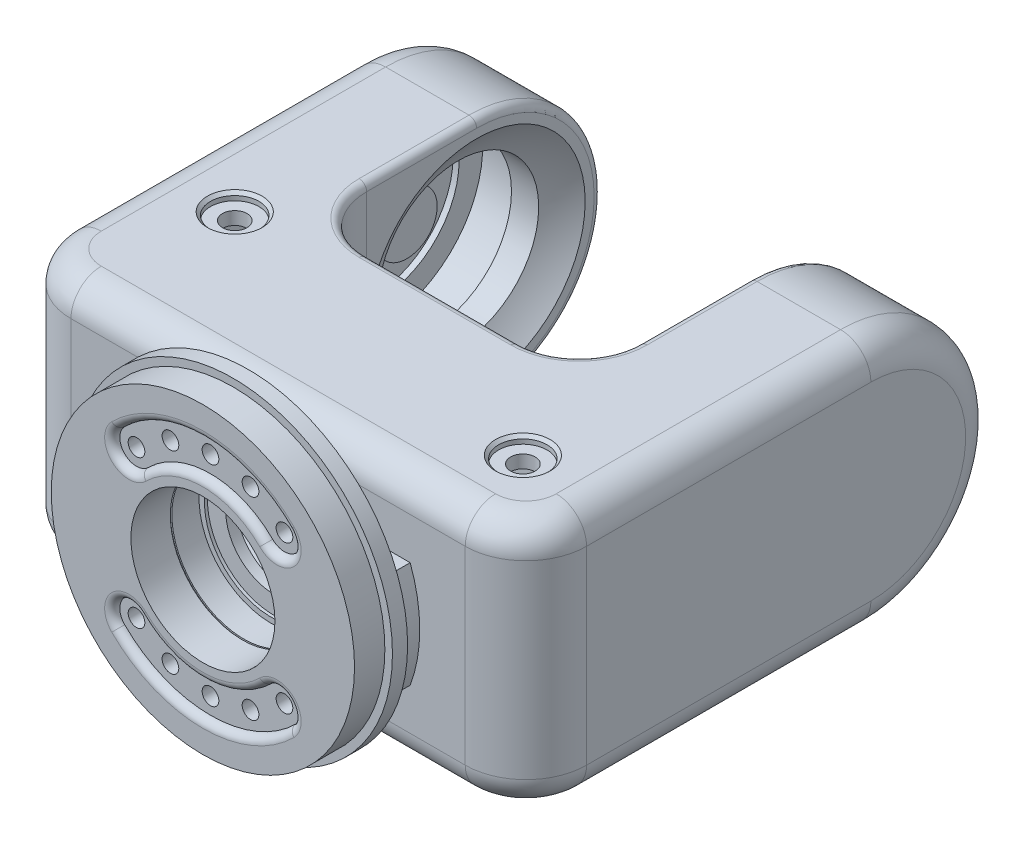
from build123d import *
from build123d.topology import SkipClean

# Parameters (mm, degrees)
SKETCH1_R                  = 100
EXTRUDE1_DEPTH             = 15
F_11_0_11_DIAMETER_HOLE3_D = 11
EXTRUDE2_DEPTH             = 5
FILLET1_R                  = 5
SKETCH12_R                 = 58
EXTRUDE6_DEPTH             = 23
EXTRUDE7_REACH             = 153.026
EXTRUDE12_DEPTH            = 82.5
FILLET2_RADIUS             = 82.5
FILLET2_LENGTH             = 80
FILLET3_RADIUS             = 82.5
FILLET3_LENGTH             = 80
EXTRUDE13_DEPTH            = 69
FILLET4_R                  = 20
SKETCH24_R                 = 53
EXTRUDE14_DEPTH            = 155
SKETCH27_R                 = 69
EXTRUDE16_DEPTH            = 35
EXTRUDE17_START            = 35
SKETCH28_R                 = 69
EXTRUDE17_DEPTH            = 35
SKETCH30_R                 = 53.5
EXTRUDE18_DEPTH            = 4
FILLET5_R                  = 8
SKETCH34_R                 = 26
EXTRUDE19_DEPTH            = 138
SKETCH35_R                 = 16
EXTRUDE21_DEPTH            = 5
CHAMFER2_SIZE              = 2
EXTRUDE22_DEPTH            = 392.336173
EXTRUDE22_DEPTH_BACK       = 392.336173
SKETCH36_R                 = 8.1
FILLET6_R                  = 5
SKETCH37_R                 = 105
SKETCH37_R_2               = 100
EXTRUDE23_DEPTH            = 10


with BuildPart() as part:
    # Sketch1 → Extrude1 (new, symmetric)
    with BuildSketch(Plane.XY):
        Circle(SKETCH1_R)
    extrude(amount=EXTRUDE1_DEPTH, both=True)

    # Ø11.0 (11) Diameter Hole3 (through all)
    with Locations(Plane(origin=(0, 0, -15), x_dir=(-1, 0, 0), z_dir=(0, 0, -1))):
        with Locations((-48.790368, 48.790368), (-26.405157, 63.747688), (0, 69), (26.405157, 63.747688), (48.790368, 48.790368), (48.790368, -48.790368), (26.405157, -63.747688), (0, -69), (-26.405157, -63.747688), (-48.790368, -48.790368)):
            Hole(F_11_0_11_DIAMETER_HOLE3_D / 2)

    # Sketch2 → Extrude2 (cut)
    with BuildSketch(Plane.XY.offset(15)):
        with BuildLine():
            ThreePointArc((56.568542, 56.568542), (0, 80), (-56.568542, 56.568542))
            ThreePointArc((-56.568542, 56.568542), (-56.568542, 41.012193), (-41.012193, 41.012193))
            ThreePointArc((-41.012193, 41.012193), (0, 58), (41.012193, 41.012193))
            ThreePointArc((41.012193, 41.012193), (56.568542, 41.012193), (56.568542, 56.568542))
        make_face()
        with BuildLine():
            ThreePointArc((56.568542, -56.568542), (0, -80), (-56.568542, -56.568542))
            ThreePointArc((-56.568542, -56.568542), (-56.568542, -41.012193), (-41.012193, -41.012193))
            ThreePointArc((-41.012193, -41.012193), (0, -58), (41.012193, -41.012193))
            ThreePointArc((41.012193, -41.012193), (56.568542, -41.012193), (56.568542, -56.568542))
        make_face()
    extrude(amount=-EXTRUDE2_DEPTH, mode=Mode.SUBTRACT)

    # Fillet1
    fillet1_edges = [part.edges().sort_by_distance(p)[0] for p in [
        (-56.568542, -41.012193, 15),
        (0, -80, 15),
        (56.568542, -41.012193, 15),
        (0, -58, 15),
        (0, 80, 15),
        (-56.568542, 41.012193, 15),
        (56.568542, 41.012193, 15),
        (0, 58, 15),
    ]]
    fillet(fillet1_edges, radius=FILLET1_R - 0.0001)  # a hair under: the kernel refuses the full size

    # Sketch12 → Extrude6 (add)
    with BuildSketch(Plane(origin=(0, 0, -15), x_dir=(-1, 0, 0), z_dir=(0, 0, -1))):
        with Locations(Location((0, 0, 0), (0, 0, 180))):
            Circle(SKETCH12_R)
    extrude(amount=EXTRUDE6_DEPTH)

    # Sketch15 → Cut-Revolve1 (revolve, cut)
    with BuildSketch(Plane(origin=(0, 0, 0), x_dir=(1, 0, 0), z_dir=(0, 1, 0))):
        Polygon((0, 38), (32, 38), (32, 32), (44, 32), (44, 30), (47.5, 30), (47.5, 12), (48.5, 12), (48.5, 11), (47.5, 11), (47.5, -15), (0, -15), align=None)
    revolve(axis=Axis((0, 0, 15), (0, 0, -1)), mode=Mode.SUBTRACT)

    # Sketch16 → Extrude7 (add, up to next)
    with BuildSketch(Plane(origin=(0, 0, -38), x_dir=(-1, 0, 0), z_dir=(0, 0, -1)), mode=Mode.PRIVATE) as extrude7_sk1:
        with BuildLine():
            Line((-93.67497, 35), (-46.249324, 35))
            ThreePointArc((-46.249324, 35), (-58, 0), (-46.249324, -35))
            Line((-46.249324, -35), (-93.67497, -35))
            ThreePointArc((-93.67497, -35), (-100, 0), (-93.67497, 35))
        make_face()
    extrude7_tool1 = extrude(extrude7_sk1.sketch, amount=-EXTRUDE7_REACH, mode=Mode.PRIVATE) - part.part
    # Sketch16 → Extrude7 (add, up to next)
    with BuildSketch(Plane(origin=(0, 0, -38), x_dir=(-1, 0, 0), z_dir=(0, 0, -1)), mode=Mode.PRIVATE) as extrude7_sk2:
        with BuildLine():
            Line((46.249324, 35), (93.67497, 35))
            ThreePointArc((93.67497, 35), (100, 0), (93.67497, -35))
            Line((93.67497, -35), (46.249324, -35))
            ThreePointArc((46.249324, -35), (58, 0), (46.249324, 35))
        make_face()
    extrude7_tool2 = extrude(extrude7_sk2.sketch, amount=-EXTRUDE7_REACH, mode=Mode.PRIVATE) - part.part
    add(extrude7_tool1.solids().sort_by_distance((75.992672, 0, -38))[0])
    add(extrude7_tool2.solids().sort_by_distance((-75.992672, 0, -38))[0])

    # Sketch20 → Extrude12 (add, symmetric)
    with BuildSketch(Plane(origin=(0, 0, 0), x_dir=(1, 0, 0), z_dir=(0, 1, 0))):
        with BuildLine():
            Line((-50, 143), (50, 143))
            ThreePointArc((50, 143), (78.284271, 154.715729), (90, 183))
            Line((90, 183), (90, 338))
            Line((90, 338), (170, 338))
            Line((170, 338), (170, 68))
            ThreePointArc((170, 68), (158.284271, 39.715729), (130, 28))
            Line((130, 28), (-130, 28))
            ThreePointArc((-130, 28), (-158.284271, 39.715729), (-170, 68))
            Line((-170, 68), (-170, 338))
            Line((-170, 338), (-90, 338))
            Line((-90, 338), (-90, 183))
            ThreePointArc((-90, 183), (-78.284271, 154.715729), (-50, 143))
        make_face()
    extrude(amount=EXTRUDE12_DEPTH, both=True)

    # Fillet2: full round fillet: the end face becomes a half cylinder, R = half its width
    fillet2_face = Plane((130, 0, -338), x_dir=(-1, 0, 0), z_dir=(0, 0, -1))  # on the end face: x along it, z out of the body
    fillet2_slab = fillet2_face.offset(-FILLET2_RADIUS / 2) * Box(FILLET2_LENGTH, 2 * FILLET2_RADIUS, FILLET2_RADIUS, mode=Mode.PRIVATE)  # the body's end, R deep
    fillet2_round = Plane((130, 0, -255.5), x_dir=(0, 0, -1), z_dir=(-1, 0, 0)) * Cylinder(FILLET2_RADIUS, FILLET2_LENGTH, mode=Mode.PRIVATE)  # its axis R under the face
    add(fillet2_slab - fillet2_round, mode=Mode.SUBTRACT)

    # Fillet3: full round fillet: the end face becomes a half cylinder, R = half its width
    fillet3_face = Plane((-130, 0, -338), x_dir=(-1, 0, 0), z_dir=(0, 0, -1))  # on the end face: x along it, z out of the body
    fillet3_slab = fillet3_face.offset(-FILLET3_RADIUS / 2) * Box(FILLET3_LENGTH, 2 * FILLET3_RADIUS, FILLET3_RADIUS, mode=Mode.PRIVATE)  # the body's end, R deep
    fillet3_round = Plane((-130, 0, -255.5), x_dir=(0, 0, -1), z_dir=(-1, 0, 0)) * Cylinder(FILLET3_RADIUS, FILLET3_LENGTH, mode=Mode.PRIVATE)  # its axis R under the face
    add(fillet3_slab - fillet3_round, mode=Mode.SUBTRACT)

    # Sketch21 → Cut-Revolve2 (revolve, cut)
    with BuildSketch(Plane(origin=(0, 0, 0), x_dir=(1, 0, 0), z_dir=(0, 1, 0)), mode=Mode.PRIVATE) as cut_revolve2_sk:
        with BuildLine():
            Line((0, 370.5), (0, 153))
            Line((0, 153), (52.141634, 153))
            ThreePointArc((52.141634, 153), (111.831346, 282.309513), (0, 370.5))
        make_face()
    revolve(cut_revolve2_sk.sketch.rotate(Axis((0, 0, -370.5), (0, 0, 1)), 159.512685), axis=Axis((0, 0, -370.5), (0, 0, 1)), mode=Mode.SUBTRACT)

    # Sketch23 → Extrude13 (cut, symmetric)
    with BuildSketch(Plane(origin=(0, 0, 0), x_dir=(1, 0, 0), z_dir=(0, 1, 0))):
        with BuildLine():
            Line((-155, 255.5), (-120, 255.5))
            Line((-120, 255.5), (-120, 168))
            ThreePointArc((-120, 168), (-108.284271, 139.715729), (-80, 128))
            Line((-80, 128), (80, 128))
            ThreePointArc((80, 128), (108.284271, 139.715729), (120, 168))
            Line((120, 168), (120, 255.5))
            Line((120, 255.5), (155, 255.5))
            Line((155, 255.5), (155, 86))
            ThreePointArc((155, 86), (143.284271, 57.715729), (115, 46))
            Line((115, 46), (-115, 46))
            ThreePointArc((-115, 46), (-143.284271, 57.715729), (-155, 86))
            Line((-155, 86), (-155, 255.5))
        make_face()
    extrude(amount=EXTRUDE13_DEPTH, both=True, mode=Mode.SUBTRACT)

    # Fillet4
    fillet4_edges = [part.edges().sort_by_distance(p)[0] for p in [
        (-158.284271, -82.5, -39.715729),
        (0, -82.5, -28),
        (158.284271, -82.5, -39.715729),
        (170, -82.5, -161.75),
        (-158.284271, 82.5, -39.715729),
        (0, 82.5, -28),
        (158.284271, 82.5, -39.715729),
        (170, 82.5, -161.75),
        (170, -58.336309, -313.836309),
        (-170, -82.5, -161.75),
        (-170, 82.5, -161.75),
        (-170, -58.336309, -313.836309),
    ]]
    fillet(fillet4_edges, radius=FILLET4_R)

    # Sketch24 → Extrude14 (cut, symmetric)
    with SkipClean():  # the faces are left unmerged after this step: merging them gives an invalid solid
        with BuildSketch(Plane(origin=(0, 0, 0), x_dir=(0, 0, -1), z_dir=(1, 0, 0))):
            with Locations(Location((255.5, 0, 0), (0, 0, 90))):
                Circle(SKETCH24_R)
        extrude(amount=EXTRUDE14_DEPTH, both=True, mode=Mode.SUBTRACT)

    # Sketch27 → Extrude16 (cut)
    with SkipClean():  # the faces are left unmerged after this step: merging them gives an invalid solid
        with BuildSketch(Plane(origin=(-155, 0, 0), x_dir=(0, 0, -1), z_dir=(1, 0, 0))):
            with Locations((255.5, 0)):
                Circle(SKETCH27_R)
        extrude(amount=EXTRUDE16_DEPTH, mode=Mode.SUBTRACT)

    # Sketch28 → Extrude17 (cut)
    with SkipClean():  # the faces are left unmerged after this step: merging them gives an invalid solid
        with BuildSketch(Plane.ZY.offset(-155).offset(EXTRUDE17_START)):
            with Locations((-255.5, 0)):
                Circle(SKETCH28_R)
        extrude(amount=-EXTRUDE17_DEPTH, mode=Mode.SUBTRACT)

    # Sketch29 → Cut-Revolve3 (revolve, cut)
    with SkipClean():  # the faces are left unmerged after this step: merging them gives an invalid solid
        with BuildSketch(Plane(origin=(0, 0, 0), x_dir=(1, 0, 0), z_dir=(0, 1, 0))):
            Polygon((0, 28), (47.5, 28), (47.5, 30), (44, 30), (44, 32), (32, 32), (32, 39), (53.5, 39), (53.5, 127), (34.5, 127), (34.5, 143), (0, 143), align=None)
        revolve(axis=Axis((0, 0, 15), (0, 0, -1)), mode=Mode.SUBTRACT)

    # Sketch30 → Extrude18 (cut)
    with SkipClean():  # the faces are left unmerged after this step: merging them gives an invalid solid
        with BuildSketch(Plane(origin=(-155, 0, 0), x_dir=(0, 0, -1), z_dir=(1, 0, 0))):
            with Locations((255.5, 0)):
                Circle(SKETCH30_R)
        extrude18 = extrude(amount=-EXTRUDE18_DEPTH, mode=Mode.SUBTRACT)

    # Mirror1: Extrude18 across plane
    with SkipClean():  # the faces are left unmerged after this step: merging them gives an invalid solid
        add(extrude18.mirror(Plane(origin=(0, 0, 0), x_dir=(0, 0, 1), z_dir=(1, 0, 0))), mode=Mode.SUBTRACT)

    # Sketch33 → Revolve1 (revolve)
    with SkipClean():  # the faces are left unmerged after this step: merging them gives an invalid solid
        with BuildSketch(Plane(origin=(0, 0, 0), x_dir=(1, 0, 0), z_dir=(0, 1, 0)), mode=Mode.PRIVATE) as revolve1_sk:
            Polygon((159, 255.5), (159, 278), (151, 278), (151, 275.5), (136, 275.5), (136, 255.5), align=None)
        revolve1 = revolve(revolve1_sk.sketch.rotate(Axis((170, 0, -255.5), (1, 0, 0)), 180), axis=Axis((170, 0, -255.5), (1, 0, 0)))

    # Mirror2: Revolve1 across plane
    with SkipClean():  # the faces are left unmerged after this step: merging them gives an invalid solid
        add(revolve1.mirror(Plane(origin=(0, 0, 0), x_dir=(0, 0, 1), z_dir=(1, 0, 0))))

    # Fillet5
    fillet5_edges = [part.edges().sort_by_distance(p)[0] for p in [
        (159, 0, -278),
        (-159, 0, -278),
    ]]
    fillet(fillet5_edges, radius=FILLET5_R - 0.0001)  # a hair under: the kernel refuses the full size

    # Sketch34 → Extrude19 (cut)
    with SkipClean():  # the faces are left unmerged after this step: merging them gives an invalid solid
        with BuildSketch(Plane.XZ.offset(-69)):
            with Locations((-117, -123)):
                Circle(SKETCH34_R)
        extrude(amount=EXTRUDE19_DEPTH, mode=Mode.SUBTRACT)

    # Sketch35 → Extrude21 (cut)
    with SkipClean():  # the faces are left unmerged after this step: merging them gives an invalid solid
        with BuildSketch(Plane.XZ.offset(82.5)):
            with Locations(Location((-117, -123, 0), (0, 0, 270))):
                Circle(SKETCH35_R)
            with Locations(Location((117, -79, 0), (0, 0, 270))):
                Circle(SKETCH35_R)
        extrude21 = extrude(amount=-EXTRUDE21_DEPTH, mode=Mode.SUBTRACT)

    # Mirror5: Extrude21 across plane
    with SkipClean():  # the faces are left unmerged after this step: merging them gives an invalid solid
        add(extrude21.mirror(Plane.ZX), mode=Mode.SUBTRACT)

    # Chamfer2
    chamfer2_edges = [part.edges().sort_by_distance(p)[0] for p in [
        (-117, -82.5, -107),
        (117, -82.5, -63),
        (-117, 82.5, -107),
        (117, 82.5, -63),
    ]]
    chamfer(chamfer2_edges, length=CHAMFER2_SIZE)

    # Sketch36 → Extrude22 (cut, two sides: drawn at the far end of the back side and taken through both)
    with SkipClean():  # the faces are left unmerged after this step: merging them gives an invalid solid
        with BuildSketch(Plane(origin=(0, 0, 0), x_dir=(1, 0, 0), z_dir=(0, 1, 0)).offset(-EXTRUDE22_DEPTH_BACK)):
            with Locations(Location((-117, 123, 0), (0, 0, 270))):
                Circle(SKETCH36_R)
            with Locations(Location((117, 79, 0), (0, 0, 270))):
                Circle(SKETCH36_R)
        extrude(amount=EXTRUDE22_DEPTH + EXTRUDE22_DEPTH_BACK, mode=Mode.SUBTRACT)

    # Fillet6
    fillet6_edges = [part.edges().sort_by_distance(p)[0] for p in [
        (78.284271, -82.5, -154.715729),
        (0, -82.5, -143),
        (-78.284271, -82.5, -154.715729),
        (-90, -82.5, -219.25),
        (78.284271, 82.5, -154.715729),
        (0, 82.5, -143),
        (-78.284271, 82.5, -154.715729),
        (-90, 82.5, -219.25),
        (90, 82.5, -219.25),
        (90, -82.5, -219.25),
        (90, -58.336309, -313.836309),
        (-90, -58.336309, -313.836309),
    ]]
    fillet(fillet6_edges, radius=FILLET6_R)

    # Sketch37 → Extrude23 (add)
    with SkipClean():  # the faces are left unmerged after this step: merging them gives an invalid solid
        with BuildSketch(Plane(origin=(0, 0, -15), x_dir=(-1, 0, 0), z_dir=(0, 0, -1))):
            Circle(SKETCH37_R)
            Circle(SKETCH37_R_2, mode=Mode.SUBTRACT)
        extrude(amount=-EXTRUDE23_DEPTH)


solid = part.part
